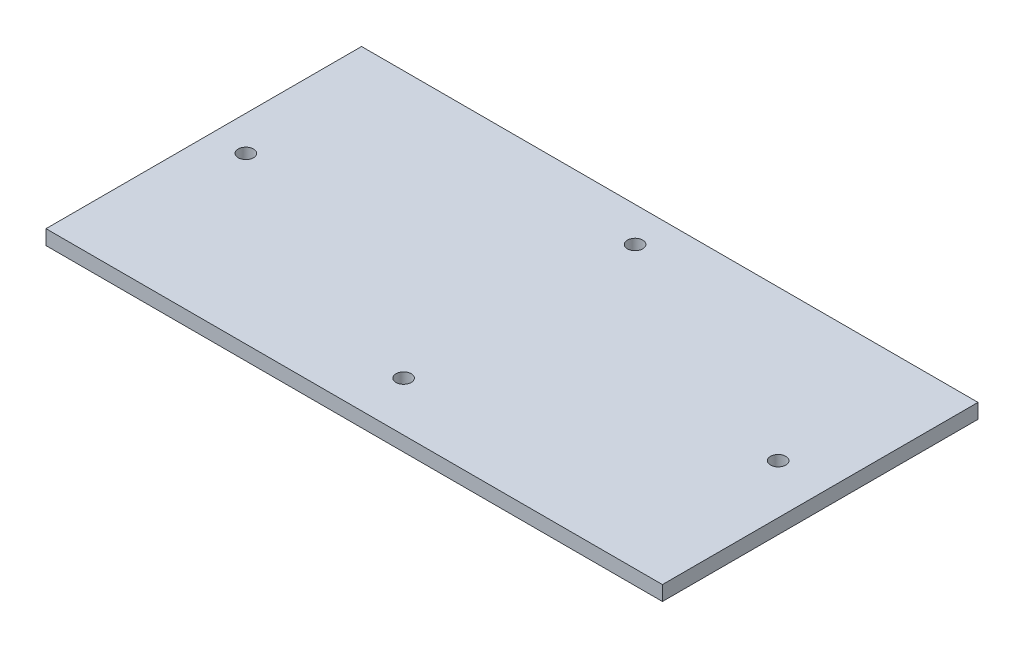
from build123d import *

# Parameters (mm, degrees)
SKETCH1_W           = 133.175
SKETCH1_H           = 68.175
SKETCH1_R           = 1.65
BOSS_EXTRUDE1_DEPTH = 3.175


with BuildPart() as part:
    # Sketch1 → Boss-Extrude1 (new body)
    with BuildSketch(Plane(origin=(0, 0, 0), x_dir=(1, 0, 0), z_dir=(0, 1, 0))):
        Rectangle(SKETCH1_W, SKETCH1_H)
        with Locations((0, 26.5875)):
            Circle(SKETCH1_R, mode=Mode.SUBTRACT)
        with Locations((-59.0875, 1.5875)):
            Circle(SKETCH1_R, mode=Mode.SUBTRACT)
        with Locations((55.9125, 1.5875)):
            Circle(SKETCH1_R, mode=Mode.SUBTRACT)
        with Locations((0, -23.4125)):
            Circle(SKETCH1_R, mode=Mode.SUBTRACT)
    extrude(amount=BOSS_EXTRUDE1_DEPTH)


solid = part.part
